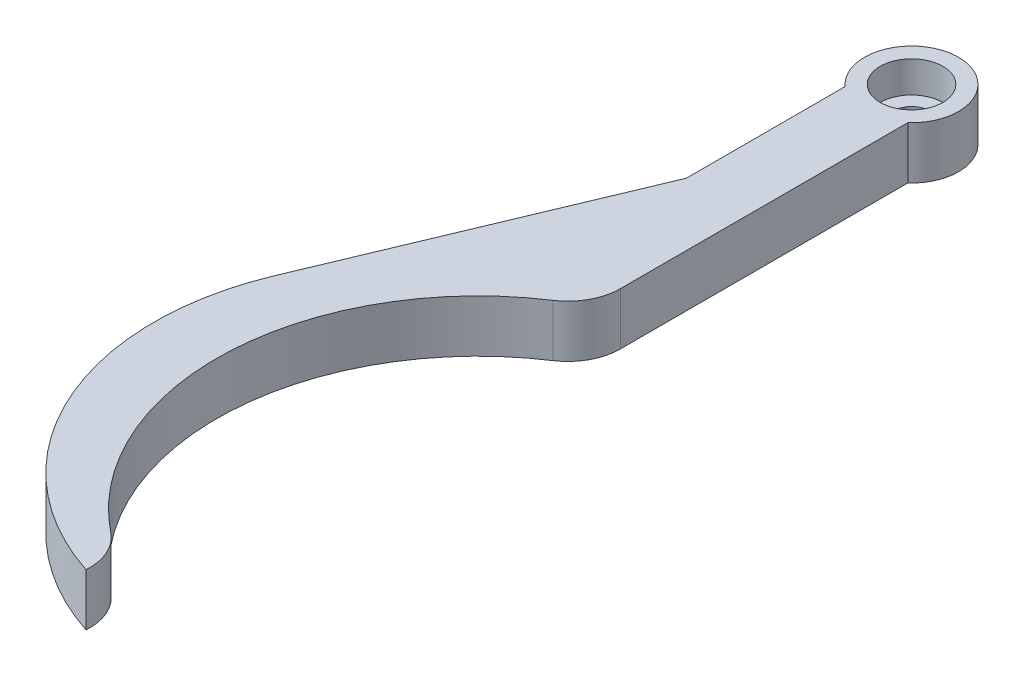
from build123d import *

# Parameters (mm, degrees)
EXTRUDE_2_DEPTH     = 5
SKETCH_4_R          = 1.65
CUT_EXTRUDE_1_DEPTH = 5
EXTRUDE_3_DEPTH     = 5
SKETCH_7_R          = 3
CUT_EXTRUDE_2_DEPTH = 3
CUT_EXTRUDE_3_DEPTH = 7.5
EXTRUDE_4_DEPTH     = 5
FILLET_1_R          = 5


with BuildPart() as part:
    # 草图3 → 凸台-拉伸2 (new body)
    with BuildSketch(Plane(origin=(0, 0, 0), x_dir=(1, 0, 0), z_dir=(0, 1, 0))):
        with BuildLine():
            Line((-3, -3.354101966), (-3, -7.416198487))
            Line((-3, -7.416198487), (-3, -43.854101966))
            Line((-3, -43.854101966), (3, -43.854101966))
            Line((3, -43.854101966), (3, -10.583005244))
            Line((3, -10.583005244), (3, -7.416198487))
            Line((3, -7.416198487), (3, -3.354101966))
            ThreePointArc((3, -3.354101966), (0, 4.5), (-3, -3.354101966))
        make_face()
    extrude(amount=EXTRUDE_2_DEPTH)

    # 草图4 → 切除-拉伸1 (cut)
    with BuildSketch(Plane(origin=(0, 5, 0), x_dir=(1, 0, 0), z_dir=(0, 1, 0))):
        with Locations(Location((0, 0, 0), (0, 0, 270))):
            Circle(SKETCH_4_R)
    extrude(amount=-CUT_EXTRUDE_1_DEPTH, mode=Mode.SUBTRACT)

    # 草图6 → 凸台-拉伸3 (add)
    with BuildSketch(Plane(origin=(0, 5, 0), x_dir=(1, 0, 0), z_dir=(0, 1, 0))):
        with BuildLine():
            Line((3, -33.74604712), (-3, -33.74604712))
            ThreePointArc((-3, -33.74604712), (-16.46902092, -57.986607816), (0.722500961, -79.745993902))
            Line((0.722500961, -79.745993902), (1.949520222, -77.620734201))
            ThreePointArc((1.949520222, -77.620734201), (-10.543317179, -55.371702353), (3, -33.74604712))
        make_face()
    extrude(amount=-EXTRUDE_3_DEPTH)

    # 草图7 → 切除-拉伸2 (cut)
    with BuildSketch(Plane(origin=(0, 5, 0), x_dir=(1, 0, 0), z_dir=(0, 1, 0))):
        with Locations(Location((0, 0, 0), (0, 0, 270))):
            Circle(SKETCH_7_R)
    extrude(amount=-CUT_EXTRUDE_2_DEPTH, mode=Mode.SUBTRACT)

    # 草图8 → 切除-拉伸3 (cut)
    with BuildSketch(Plane(origin=(0, 5, 0), x_dir=(1, 0, 0), z_dir=(0, 1, 0))):
        with BuildLine():
            Line((-3, -38.067187498), (-3, -43.854101966))
            Line((-3, -43.854101966), (3, -43.854101966))
            Line((3, -43.854101966), (3, -33.74604712))
            ThreePointArc((3, -33.74604712), (-0.160637142, -35.683569047), (-3, -38.067187498))
        make_face()
    extrude(amount=-CUT_EXTRUDE_3_DEPTH, mode=Mode.SUBTRACT)

    # 草图9 → 凸台-拉伸4 (add)
    with BuildSketch(Plane(origin=(0, 5, 0), x_dir=(1, 0, 0), z_dir=(0, 1, 0))):
        with BuildLine():
            Line((-3, -18.550074543), (-14.614967684, -46.324924269))
            ThreePointArc((-14.614967684, -46.324924269), (-9.917875534, -39.010182445), (-3, -33.74604712))
            Line((-3, -33.74604712), (-3, -18.550074543))
        make_face()
    extrude(amount=-EXTRUDE_4_DEPTH)

    # 圆角1
    # the kernel refuses this fillet: 5 mm, written as the material it takes off along each edge
    with BuildSketch(Plane(origin=(1.949520222, 14.371610933, 77.620734201), x_dir=(-0.4999999999999996, 0, 0.8660254037844388), z_dir=(0, -1, 0))) as fillet_1_piece_1:
        with BuildLine():
            CenterArc((4.662743969, 4.485712903), FILLET_1_R, 188.59932897, 55.185648669)
            Line((-0.281046693, 3.738094086), (-0.379922506, 3.723141709))
            ThreePointArc((-0.379922506, 3.723141709), (-0.170079243, 1.866824898), (-0.1, 0))
            Line((-0.1, 0), (0, -0.1))
            ThreePointArc((0, -0.1), (1.227019261, -0.1), (2.409864412, -0.089714258))
            Line((2.409864412, -0.089714258), (2.454038521, 0))
        make_face()
    extrude(amount=23.743221866, mode=Mode.SUBTRACT)
    with BuildSketch(Plane(origin=(3, 12.160146085, 33.74604712), x_dir=(0, 0, -1), z_dir=(0, -1, 0))) as fillet_1_piece_2:
        with BuildLine():
            CenterArc((2.864058434, -5), FILLET_1_R, 90, 56.748348073)
            Line((-1.317293303, -2.258413296), (-1.400920337, -2.203581562))
            ThreePointArc((-1.400920337, -2.203581562), (-0.715482953, -1.096055019), (-0.088896208, 0.045798081))
            Line((-0.088896208, 0.045798081), (0, 0.1))
            Line((0, 0.1), (2.864058434, 0.1))
            Line((2.864058434, 0.1), (2.864058434, 0))
        make_face()
    extrude(amount=19.320292171, mode=Mode.SUBTRACT)


solid = part.part
